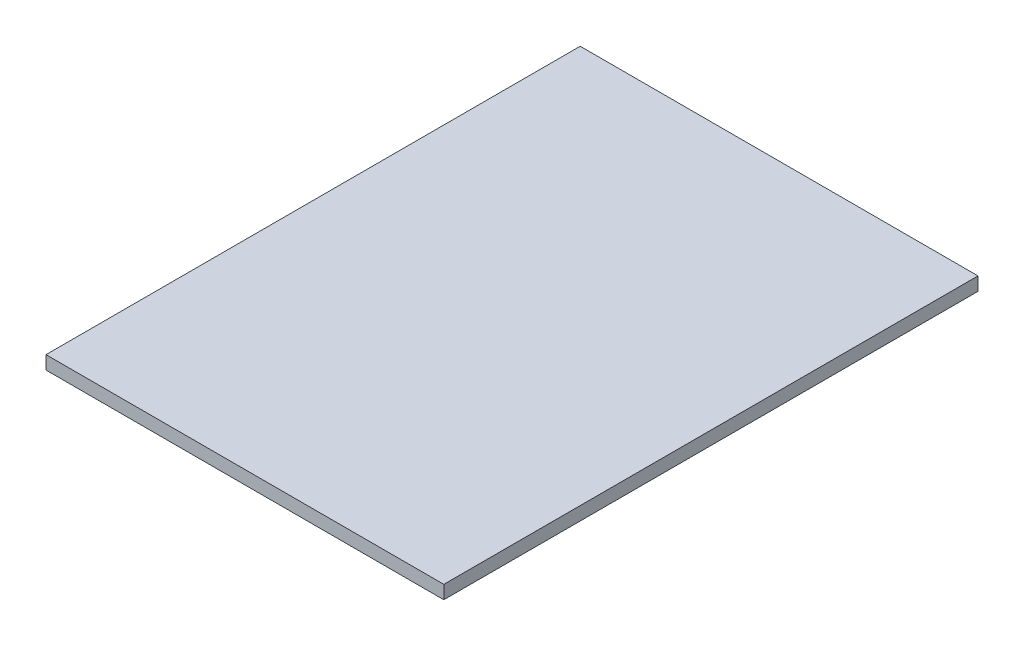
from build123d import *

# Parameters (mm, degrees)
SKETCH1_W           = 297.5
SKETCH1_H           = 399.5
BOSS_EXTRUDE1_DEPTH = 10


with BuildPart() as part:
    # Sketch1 → Boss-Extrude1 (new body)
    with BuildSketch(Plane(origin=(0, 0, 0), x_dir=(1, 0, 0), z_dir=(0, 1, 0))):
        with Locations((148.75, 199.75)):
            Rectangle(SKETCH1_W, SKETCH1_H)
    extrude(amount=BOSS_EXTRUDE1_DEPTH)


solid = part.part
